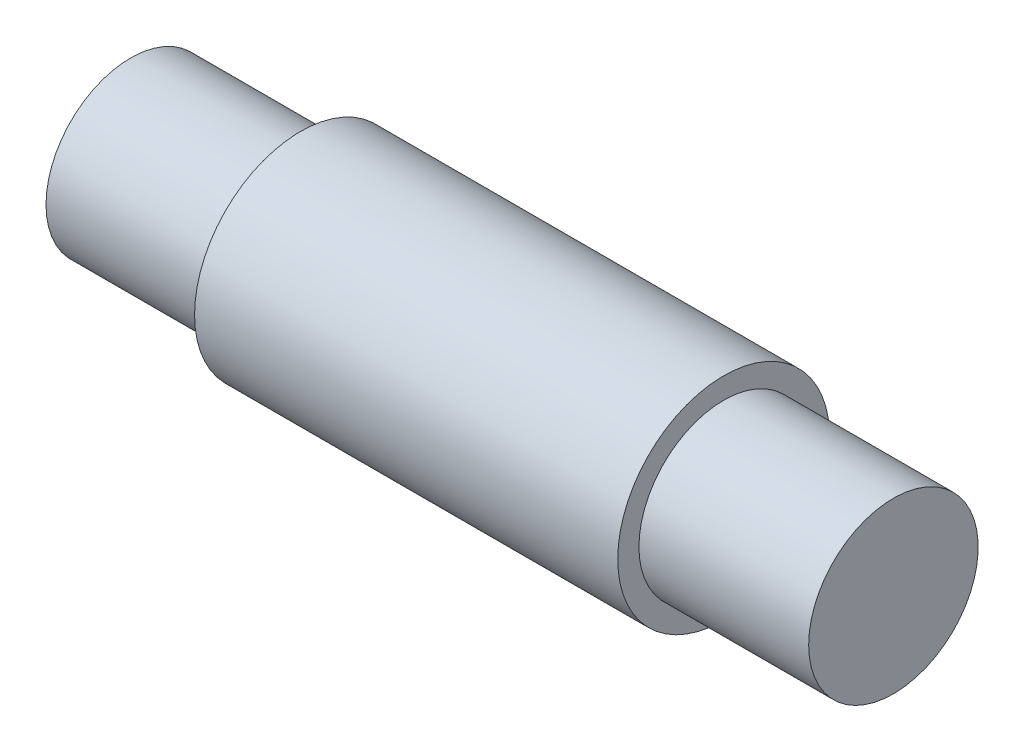
from build123d import *


with BuildPart() as part:
    # Sketch1 → Revolve1 (revolve)
    with BuildSketch(Plane.XY):
        Polygon((-14.2875, 0), (-14.2875, 3.175), (-7.9275, 3.175), (-7.9275, 3.96875), (7.9275, 3.96875), (7.9275, 3.175), (14.2875, 3.175), (14.2875, 0), align=None)
    revolve(axis=Axis((-76.456488796, 0, 0), (1, 0, 0)))


solid = part.part
